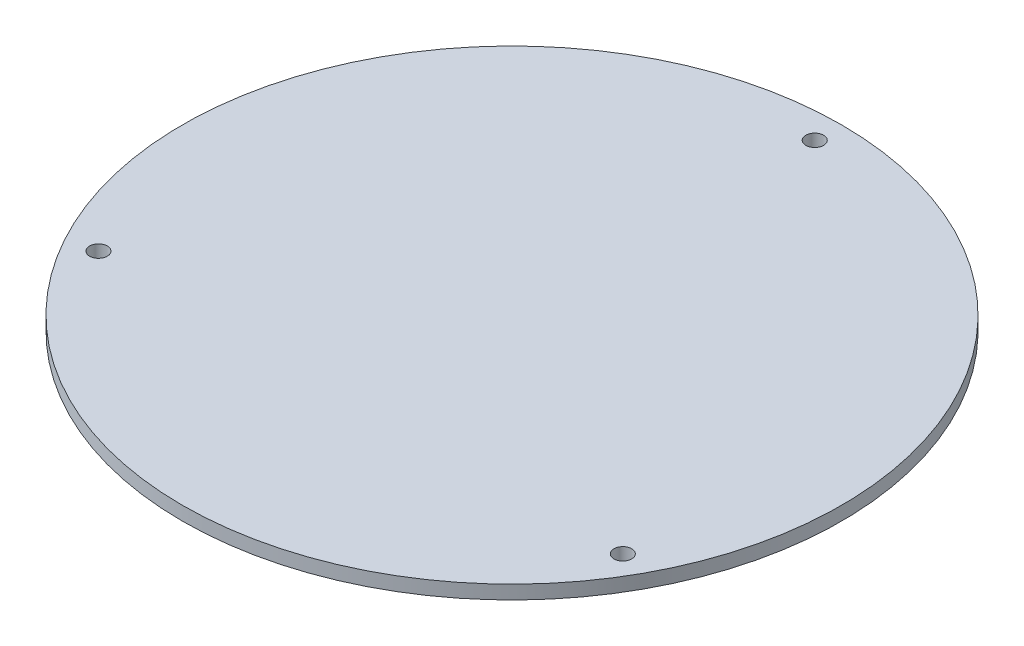
from build123d import *

# Parameters (mm, degrees)
SKETCH1_R           = 152.4
BOSS_EXTRUDE1_DEPTH = 6.35
SKETCH2_R           = 4.1
CUT_EXTRUDE1_DEPTH  = 216.619670949
CIRPATTERN1_COUNT   = 3


with BuildPart() as part:
    # Sketch1 → Boss-Extrude1 (new body)
    with BuildSketch(Plane(origin=(0, 0, 0), x_dir=(1, 0, 0), z_dir=(0, 1, 0))):
        Circle(SKETCH1_R)
    extrude(amount=BOSS_EXTRUDE1_DEPTH)

    # Sketch2 → Cut-Extrude1 (cut, through all)
    with BuildSketch(Plane(origin=(0, 6.35, 0), x_dir=(1, 0, 0), z_dir=(0, 1, 0))):
        with Locations((0, 140)):
            Circle(SKETCH2_R)
    cut_extrude1 = extrude(amount=-CUT_EXTRUDE1_DEPTH, mode=Mode.SUBTRACT)

    # CirPattern1: Cut-Extrude1 ×3 about axis
    cirpattern1_axis = Axis((0, 6.35, 0), (0, -1, 0))
    for i in range(1, CIRPATTERN1_COUNT):
        add(cut_extrude1.rotate(cirpattern1_axis, i * 360 / CIRPATTERN1_COUNT), mode=Mode.SUBTRACT)


solid = part.part
